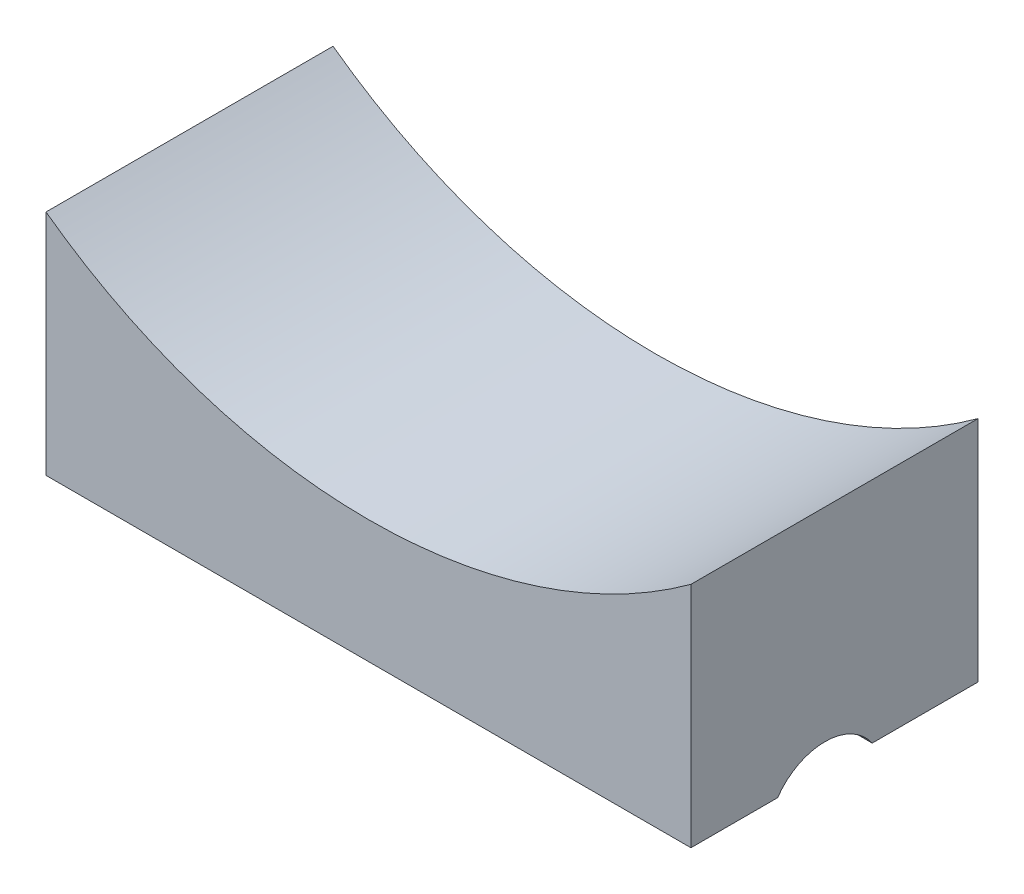
from build123d import *

# Parameters (mm, degrees)
SKETCH1_W           = 15
SKETCH1_H           = 12
BOSS_EXTRUDE1_DEPTH = 33.7
SKETCH3_R           = 28.575
CUT_EXTRUDE1_DEPTH  = 39.790333847
SKETCH8_R           = 3
CUT_EXTRUDE4_DEPTH  = 24.5
SKETCH9_R           = 6.22
CUT_EXTRUDE5_DEPTH  = 7.3
SKETCH10_R          = 5.1
CUT_EXTRUDE6_DEPTH  = 38.126363014


with BuildPart() as part:
    # Sketch1 → Boss-Extrude1 (new body)
    with BuildSketch(Plane(origin=(0, 0, 0), x_dir=(0, 0, -1), z_dir=(1, 0, 0))):
        with Locations((7.5, 6)):
            Rectangle(SKETCH1_W, SKETCH1_H)
    extrude(amount=BOSS_EXTRUDE1_DEPTH)

    # Sketch3 → Cut-Extrude1 (cut, through all)
    with BuildSketch(Plane.XY):
        with Locations((16.85, 35)):
            Circle(SKETCH3_R)
    extrude(amount=-CUT_EXTRUDE1_DEPTH, mode=Mode.SUBTRACT)

    # Sketch8 → Cut-Extrude4 (cut)
    with BuildSketch(Plane(origin=(33.7, 12, 0), x_dir=(0, 0, 1), z_dir=(-1, 0, 0))):
        with Locations((-7, -13.7)):
            Circle(SKETCH8_R)
    extrude(amount=CUT_EXTRUDE4_DEPTH, mode=Mode.SUBTRACT)

    # Sketch9 → Cut-Extrude5 (cut)
    with BuildSketch(Plane(origin=(9.2, 0, 0), x_dir=(0, 0, -1), z_dir=(1, 0, 0))):
        with Locations((7, -1.55)):
            Circle(SKETCH9_R)
    extrude(amount=-CUT_EXTRUDE5_DEPTH, mode=Mode.SUBTRACT)

    # Sketch10 → Cut-Extrude6 (cut, through all)
    with BuildSketch(Plane(origin=(1.9, 0, 0), x_dir=(0, 0, -1), z_dir=(1, 0, 0))):
        with Locations((7, -1.7)):
            Circle(SKETCH10_R)
    extrude(amount=-CUT_EXTRUDE6_DEPTH, mode=Mode.SUBTRACT)


solid = part.part
